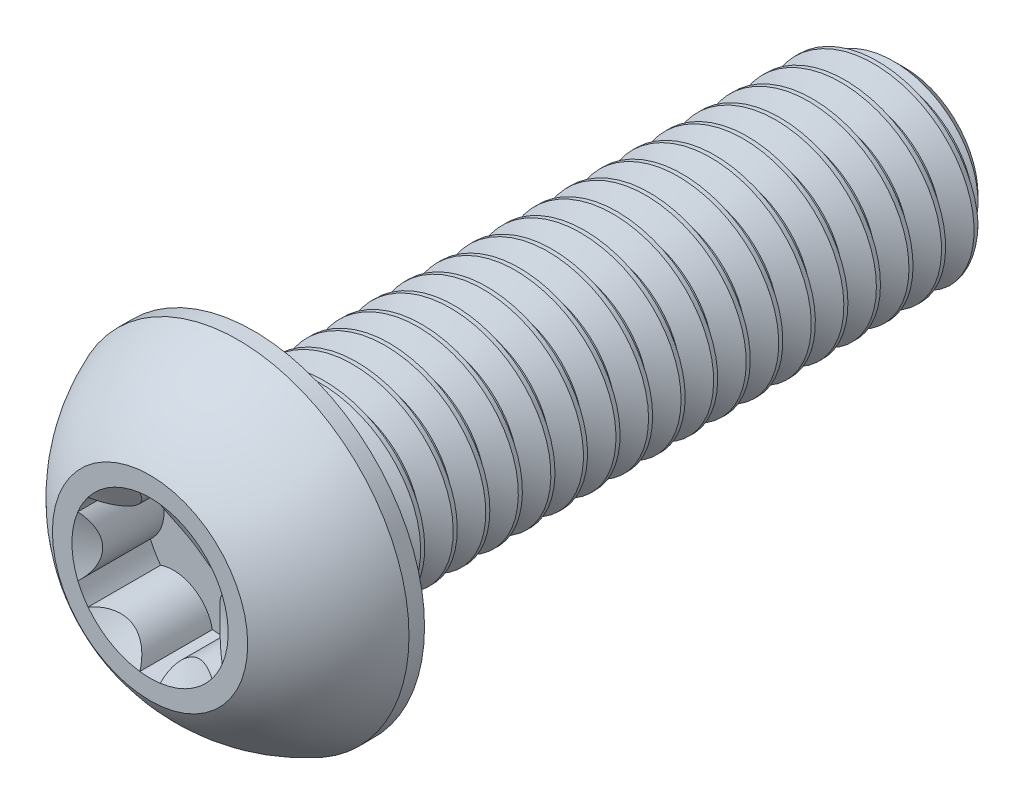
from build123d import *

# Parameters (mm, degrees)
SKETCH1_W          = 31.75
SKETCH1_H          = 4.7625
CHAMFER1_SIZE      = 1.190625
CUT_SWEEP1_PITCH   = 1.5875
CUT_EXTRUDE2_DEPTH = 3.53822
CIRPATTERN1_COUNT  = 6


with BuildPart() as part:
    # Sketch1 → Revolve1 (revolve)
    with BuildSketch(Plane(origin=(0, 0, 0), x_dir=(0, 0, -1), z_dir=(1, 0, 0))):
        with Locations((20.9296, 2.38125)):
            Rectangle(SKETCH1_W, SKETCH1_H)
    revolve(axis=Axis((0, 0, -36.8046), (0, 0, 1)))

    # Chamfer1
    chamfer1_edges = [part.edges().sort_by_distance(p)[0] for p in [
        (0, -4.7625, -36.8046),
    ]]
    chamfer(chamfer1_edges, length=CHAMFER1_SIZE)

    # Cut-Sweep1: arcs per turn and ends read off the stored shape
    # Cut-Sweep1: the profile of Sketch2 profile screwed along a right-hand helix through 21 turns, 8 arcs to a turn; built about Z, then put on its axis
    cut_sweep1_z = Axis((0, 0, 0), (0, 0, 1))
    cut_sweep1_corners = [(4.7628, 0, 0.000173205), (4.7628, 0, -1.389235705), (3.731388504, 0, -0.79375), (3.731388504, 0, -0.5953125)]
    with BuildLine(mode=Mode.PRIVATE) as cut_sweep1_profile:
        Line(cut_sweep1_corners[0], cut_sweep1_corners[1])
        Line(cut_sweep1_corners[1], cut_sweep1_corners[2])
        Line(cut_sweep1_corners[2], cut_sweep1_corners[3])
        Line(cut_sweep1_corners[3], cut_sweep1_corners[0])
    cut_sweep1_cap = Face(cut_sweep1_profile.wire())
    cut_sweep1_turn_angles = [0, 22.5, 45, 67.5, 90, 112.5, 135, 157.5, 180, 202.5, 225, 247.5, 270, 292.5, 315, 337.5, 360]
    cut_sweep1_turn_weights = [1, 0.9238795325112867, 1, 0.9238795325112867, 1, 0.9238795325112867, 1, 0.9238795325112867, 1, 0.9238795325112867, 1, 0.9238795325112867, 1, 0.9238795325112867, 1, 0.9238795325112867, 1]
    cut_sweep1_turn_rails = [Edge.make_bspline([Vector(p[0], p[1], 0).rotate(cut_sweep1_z, cut_sweep1_turn_angles[k]) / cut_sweep1_turn_weights[k] + Vector(0, 0, p[2] + CUT_SWEEP1_PITCH * cut_sweep1_turn_angles[k] / 360) for k in range(17)], [0, 0, 0, 1, 1, 2, 2, 3, 3, 4, 4, 5, 5, 6, 6, 7, 7, 8, 8, 8], 2, cut_sweep1_turn_weights) for p in cut_sweep1_corners]
    cut_sweep1_turn_sides = [Face.make_surface_from_curves(cut_sweep1_turn_rails[p[0]], cut_sweep1_turn_rails[p[1]]) for p in [(0, 1), (1, 2), (2, 3), (3, 0)]]
    cut_sweep1 = Plane(origin=(0, 0, -36.8046), x_dir=(0, 1, 0), z_dir=(0, 0, 1)) * Solid(Shell([*[p.moved(Location((0, 0, CUT_SWEEP1_PITCH * i))) for i in range(21) for p in cut_sweep1_turn_sides], cut_sweep1_cap, cut_sweep1_cap.rotate(cut_sweep1_z, 7560).moved(Location((0, 0, CUT_SWEEP1_PITCH * 7560 / 360)))]))
    add(cut_sweep1, mode=Mode.SUBTRACT)

    # Sketch7 → Revolve2 (revolve)
    with BuildSketch(Plane(origin=(0, 0, 0), x_dir=(0, 0, -1), z_dir=(1, 0, 0)), mode=Mode.PRIVATE) as revolve2_sk:
        with BuildLine():
            Line((4.29641, 8.3312), (5.0546, 8.3312))
            Line((5.0546, 8.3312), (5.0546, 0))
            Line((5.0546, 0), (0, 0))
            Line((0, 0), (0, 4.7625))
            ThreePointArc((0, 4.7625), (1.862939611, 6.890285164), (4.29641, 8.3312))
        make_face()
    revolve(revolve2_sk.sketch.rotate(Axis((0, 0, 0), (0, 0, -1)), 189.052465709), axis=Axis((0, 0, 0), (0, 0, -1)))

    # Sketch5 → Cut-Extrude2 (cut)
    with BuildSketch(Plane.XY):
        with BuildLine():
            Line((-3.299556788, -1.905), (0, 0))
            Line((0, 0), (-3.299556788, 1.905))
            ThreePointArc((-3.299556788, 1.905), (-3.417085145, 1.68511991), (-3.519981019, 1.458023877))
            ThreePointArc((-3.519981019, 1.458023877), (-2.8575, 0), (-3.519981019, -1.458023877))
            ThreePointArc((-3.519981019, -1.458023877), (-3.417085145, -1.68511991), (-3.299556788, -1.905))
        make_face()
    cut_extrude2 = extrude(amount=-CUT_EXTRUDE2_DEPTH, mode=Mode.SUBTRACT)

    # CirPattern1: Cut-Extrude2 ×6 about axis
    cirpattern1_axis = Axis((0, 0, 0), (0, 0, 1))
    for i in range(1, CIRPATTERN1_COUNT):
        add(cut_extrude2.rotate(cirpattern1_axis, i * 360 / CIRPATTERN1_COUNT), mode=Mode.SUBTRACT)

    # Cut-Extrude3 cone 1 section (through the dimple's axis) → Cut-Extrude3 (revolve, cut)
    with BuildSketch(Plane(origin=(0, 0, 0), x_dir=(0, -1, 0), z_dir=(1, 0, 0))):
        Polygon((0, 0), (3.81, 0), (0, 2.199704526), align=None)
    revolve(axis=Axis((0, 0, 0), (0, 0, -1)), mode=Mode.SUBTRACT)


solid = part.part
